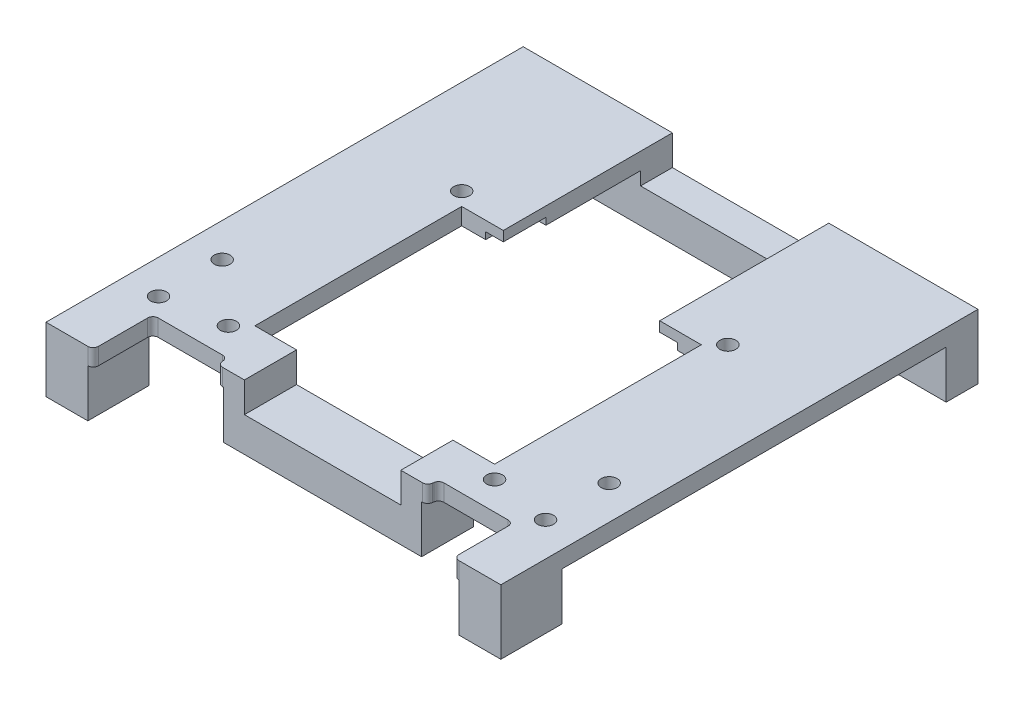
from build123d import *

# Parameters (mm, degrees)
BOSS_EXTRUDE4_DEPTH    = 1.5875
M3_CLEARANCE_HOLE3_D   = 3
M3_CLEARANCE_HOLE1_D   = 3.1
M3_CLEARANCE_HOLE4_D   = 2.95
M3_CLEARANCE_HOLE2_D   = 3.1
M3_CLEARANCE_HOLE5_D   = 3
BOSS_EXTRUDE6_START    = -3.175
BOSS_EXTRUDE6_DEPTH    = 3.175
FILLET1_R              = 2
CUT_EXTRUDE4_START     = -1.5875
CUT_EXTRUDE4_OUTLINE_W = 45.2
CUT_EXTRUDE4_OUTLINE_H = 39
CUT_EXTRUDE4_OUTLINE_R = 1.5
CUT_EXTRUDE4_DEPTH     = 3.175
CUT_EXTRUDE4_2_DEPTH   = 3.175
SKETCH29_W             = 29.5
SKETCH29_H             = 74
CUT_EXTRUDE5_DEPTH     = 121.250075364
SKETCH30_R             = 1.5
CUT_EXTRUDE6_DEPTH     = 121.250075364
SKETCH31_W             = 36.15971715
SKETCH31_H             = 8.2
CUT_EXTRUDE7_DEPTH     = 1.3
SKETCH32_OUTSIDE_W     = 217.324
SKETCH32_OUTSIDE_H     = 197.151
SKETCH32_OUTSIDE_W_2   = 85.788981544
SKETCH32_OUTSIDE_H_2   = 90
CUT_EXTRUDE8_DEPTH     = 121.250075364
SKETCH33_W             = 7.894490772
SKETCH33_H             = 11.5
SKETCH33_W_2           = 37.35
SKETCH33_H_2           = 9.832970801
SKETCH33_W_3           = 85.788981544
SKETCH33_H_3           = 6
BOSS_EXTRUDE9_DEPTH    = 9
SKETCH34_W             = 29.5
SKETCH34_H             = 9.832970801
CUT_EXTRUDE9_DEPTH     = 2.5
SKETCH35_W             = 29.5
SKETCH35_H             = 7.081145589
CUT_EXTRUDE10_DEPTH    = 5.675


# Read off the part's stored shape, not the designer's step: Cut-Extrude4
with BuildPart() as part:
    # Sketch1 → Boss-Extrude4 (new, symmetric)
    with BuildSketch(Plane(origin=(0, 0, 0), x_dir=(1, 0, 0), z_dir=(0, 1, 0))):
        with BuildLine():
            Line((-62.799553621, 32.496136604), (-73.969425011, 32.691107434))
            Line((-73.969425011, 32.691107434), (-77.053684287, 35.88495141))
            ThreePointArc((-77.053684287, 35.88495141), (-84.36642289, 10.358894189), (-83.446216027, -16.178041625))
            Line((-83.446216027, -16.178041625), (-79.680911643, -13.825218315))
            Line((-79.680911643, -13.825218315), (-69.484649137, -16.179210996))
            Line((-69.484649137, -16.179210996), (-43.894490772, -57.132025032))
            Line((-43.894490772, -57.132025032), (-43.894490772, -64.826600275))
            Line((-43.894490772, -64.826600275), (-43.094490772, -64.826600275))
            Line((-43.094490772, -64.826600275), (-34, -64.826600275))
            Line((-34, -64.826600275), (-34, -55.55))
            Line((-34, -55.55), (-34, -53.55))
            Line((-34, -53.55), (-20, -53.55))
            Line((-20, -53.55), (-19.718918331, -55.55))
            Line((-19.718918331, -55.55), (19.718918331, -55.55))
            Line((19.718918331, -55.55), (20, -53.55))
            Line((20, -53.55), (34, -53.55))
            Line((34, -53.55), (34, -55.55))
            Line((34, -55.55), (34, -64.826600275))
            Line((34, -64.826600275), (43.094490772, -64.826600275))
            Line((43.094490772, -64.826600275), (43.894490772, -64.826600275))
            Line((43.894490772, -64.826600275), (43.894490772, -57.132025032))
            Line((43.894490772, -57.132025032), (69.484649137, -16.179210996))
            Line((69.484649137, -16.179210996), (79.680911643, -13.825218315))
            Line((79.680911643, -13.825218315), (83.446216027, -16.178041625))
            ThreePointArc((83.446216027, -16.178041625), (84.610662337, -8.126242604), (85, 0))
            ThreePointArc((85, 0), (82.98964744, 18.377116688), (77.053684287, 35.88495141))
            Line((77.053684287, 35.88495141), (73.969425011, 32.691107434))
            Line((73.969425011, 32.691107434), (62.799553621, 32.496136604))
            Line((62.799553621, 32.496136604), (30.284668021, 63.895396642))
            Line((30.284668021, 63.895396642), (30.089697191, 75.065268032))
            Line((30.089697191, 75.065268032), (33.173956467, 78.259112008))
            ThreePointArc((33.173956467, 78.259112008), (0, 85), (-33.173956467, 78.259112008))
            Line((-33.173956467, 78.259112008), (-30.089697191, 75.065268032))
            Line((-30.089697191, 75.065268032), (-30.284668021, 63.895396642))
            Line((-30.284668021, 63.895396642), (-62.799553621, 32.496136604))
        make_face()
    extrude(amount=BOSS_EXTRUDE4_DEPTH, both=True)

    # M3 Clearance Hole3 (through all)
    with Locations(Plane(origin=(0, -1.5875, 0), x_dir=(-1, 0, 0), z_dir=(0, -1, 0))):
        with Locations((36.5, -50), (36.5, -38), (-36.5, -50), (-36.5, -38)):
            Hole(M3_CLEARANCE_HOLE3_D / 2)

    # M3 Clearance Hole1 (through all)
    with Locations(Plane(origin=(0, 1.5875, 0), x_dir=(1, 0, 0), z_dir=(0, 1, 0))):
        with Locations((-78.542321426, -8.49139241), (78.542321426, -8.49139241), (74.155025063, 27.240269049), (-74.155025063, 27.240269049)):
            Hole(M3_CLEARANCE_HOLE1_D / 2)

    # M3 Clearance Hole4 (through all)
    with Locations(Plane(origin=(0, -1.5875, 0), x_dir=(-1, 0, 0), z_dir=(0, -1, 0))):
        with Locations((-67.099301622, -15.278865202), (-50.141885166, -42.416404279), (-61.062544382, 30.698137949), (-38.043670771, 52.927205804), (50.141885166, -42.416404279), (67.099301622, -15.278865202), (38.043670771, 52.927205804), (61.062544382, 30.698137949)):
            Hole(M3_CLEARANCE_HOLE4_D / 2)

    # M3 Clearance Hole2 (through all)
    with Locations(Plane(origin=(0, 1.5875, 0), x_dir=(1, 0, 0), z_dir=(0, 1, 0))):
        with Locations((27, 76.497766718), (-27, 76.497766718)):
            Hole(M3_CLEARANCE_HOLE2_D / 2)

    # M3 Clearance Hole5 (through all)
    with Locations(Plane(origin=(0, 1.5875, 0), x_dir=(1, 0, 0), z_dir=(0, 1, 0))):
        with Locations((-11, -4.4), (11, -4.4), (11, -36.4), (-11, -36.4), (-11, 37.6), (11, 37.6)):
            Hole(M3_CLEARANCE_HOLE5_D / 2)

    # Sketch22 → Boss-Extrude6 (add)
    with BuildSketch(Plane(origin=(0, 1.5875, 0), x_dir=(1, 0, 0), z_dir=(0, 1, 0)).offset(BOSS_EXTRUDE6_START)):
        Polygon((65.061950694, 32.535626892), (30.245177733, 66.157793715), (30.284668021, 63.895396642), (62.799553621, 32.496136604), align=None)
        Polygon((-30.284668021, 63.895396642), (-30.245177733, 66.157793715), (-65.061950694, 32.535626892), (-62.799553621, 32.496136604), align=None)
        Polygon((43.894490772, -60.151352895), (71.689396914, -15.670204865), (69.484649137, -16.179210996), (43.894490772, -57.132025032), align=None)
        Polygon((-69.484649137, -16.179210996), (-71.689396914, -15.670204865), (-43.894490772, -60.151352895), (-43.894490772, -57.132025032), align=None)
    extrude(amount=BOSS_EXTRUDE6_DEPTH)

    # Fillet1
    fillet1_edges = [part.edges().sort_by_distance(p)[0] for p in [
        (-30.245177733, -0.79375, -66.157793715),
        (-65.061950694, -0.79375, -32.535626892),
        (-71.689396914, 0.79375, 15.670204865),
        (-43.894490772, 0.79375, 60.151352895),
        (43.894490772, -0.79375, 60.151352895),
        (71.689396914, -0.79375, 15.670204865),
        (65.061950694, -0.79375, -32.535626892),
        (30.245177733, 0.79375, -66.157793715),
        (30.089697191, -0.79375, -75.065268032),
        (73.969425011, -0.79375, -32.691107434),
        (79.680911643, -0.79375, 13.825218315),
        (-79.680911643, -0.79375, 13.825218315),
        (-73.969425011, -0.79375, -32.691107434),
        (-30.089697191, -0.79375, -75.065268032),
    ]]
    fillet(fillet1_edges, radius=FILLET1_R)

    # Cut-Extrude4 outline → Cut-Extrude4 (cut)
    # profile 1 of 13: a face of its own
    with BuildSketch(Plane(origin=(0, 0, 0), x_dir=(1, 0, 0), z_dir=(0, 1, 0)).offset(CUT_EXTRUDE4_START)):
        with BuildLine():
            Line((-43.894490772, -64.826600275), (-42.894490772, -64.826600275))
            ThreePointArc((-42.894490772, -64.826600275), (-43.601597553, -64.533707056), (-43.894490772, -63.826600275))
            Line((-43.894490772, -63.826600275), (-43.894490772, -64.826600275))
        make_face()
    # profile 2 of 13: a face of its own
    with BuildSketch(Plane(origin=(0, 0, 0), x_dir=(1, 0, 0), z_dir=(0, 1, 0)).offset(CUT_EXTRUDE4_START)):
        with BuildLine():
            ThreePointArc((43.894490772, -63.826600275), (43.601597553, -64.533707056), (42.894490772, -64.826600275))
            Line((42.894490772, -64.826600275), (43.894490772, -64.826600275))
            Line((43.894490772, -64.826600275), (43.894490772, -63.826600275))
        make_face()
    # profile 3 of 13: a face of its own
    with BuildSketch(Plane(origin=(0, 0, 0), x_dir=(1, 0, 0), z_dir=(0, 1, 0)).offset(CUT_EXTRUDE4_START)):
        with BuildLine():
            ThreePointArc((35, -64.826600275), (34.292893219, -64.533707056), (34, -63.826600275))
            Line((34, -63.826600275), (34, -64.826600275))
            Line((34, -64.826600275), (35, -64.826600275))
        make_face()
    # profile 4 of 13: a face of its own
    with BuildSketch(Plane(origin=(0, 0, 0), x_dir=(1, 0, 0), z_dir=(0, 1, 0)).offset(CUT_EXTRUDE4_START)):
        with BuildLine():
            ThreePointArc((19.839899662, -54.689173101), (19.505690622, -55.30470958), (18.849631593, -55.55))
            Line((18.849631593, -55.55), (19.718918331, -55.55))
            Line((19.718918331, -55.55), (19.839899662, -54.689173101))
        make_face()
    # profile 5 of 13: a face of its own
    with BuildSketch(Plane(origin=(0, 0, 0), x_dir=(1, 0, 0), z_dir=(0, 1, 0)).offset(CUT_EXTRUDE4_START)):
        with BuildLine():
            ThreePointArc((-18.849631593, -55.55), (-19.505690622, -55.30470958), (-19.839899662, -54.689173101))
            Line((-19.839899662, -54.689173101), (-19.718918331, -55.55))
            Line((-19.718918331, -55.55), (-18.849631593, -55.55))
        make_face()
    # profile 6 of 13: a face of its own
    with BuildSketch(Plane(origin=(0, 0, 0), x_dir=(1, 0, 0), z_dir=(0, 1, 0)).offset(CUT_EXTRUDE4_START)):
        with BuildLine():
            ThreePointArc((-34, -63.826600275), (-34.292893219, -64.533707056), (-35, -64.826600275))
            Line((-35, -64.826600275), (-34, -64.826600275))
            Line((-34, -64.826600275), (-34, -63.826600275))
        make_face()
    # profile 7 of 13: a face of its own
    with BuildSketch(Plane(origin=(0, 0, 0), x_dir=(1, 0, 0), z_dir=(0, 1, 0)).offset(CUT_EXTRUDE4_START)):
        with BuildLine():
            Line((-83.446216027, -16.178041625), (-82.20011414, -15.399390747))
            ThreePointArc((-82.20011414, -15.399390747), (-83.136963865, -15.464801791), (-83.714914754, -14.72457292))
            ThreePointArc((-83.714914754, -14.72457292), (-83.583724815, -15.451891346), (-83.446216027, -16.178041625))
        make_face()
    # profile 8 of 13: a face of its own
    with BuildSketch(Plane(origin=(0, 0, 0), x_dir=(1, 0, 0), z_dir=(0, 1, 0)).offset(CUT_EXTRUDE4_START)):
        with BuildLine():
            ThreePointArc((-77.053684287, 35.88495141), (-77.362780128, 35.213637285), (-77.666027418, 34.539661043))
            ThreePointArc((-77.666027418, 34.539661043), (-76.926166569, 35.118082978), (-76.032969649, 34.82797046))
            Line((-76.032969649, 34.82797046), (-77.053684287, 35.88495141))
        make_face()
    # profile 9 of 13: a face of its own
    with BuildSketch(Plane(origin=(0, 0, 0), x_dir=(1, 0, 0), z_dir=(0, 1, 0)).offset(CUT_EXTRUDE4_START)):
        with BuildLine():
            Line((-33.173956467, 78.259112008), (-32.153241828, 77.202131058))
            ThreePointArc((-32.153241828, 77.202131058), (-32.412005494, 78.104908648), (-31.808115147, 78.82413216))
            ThreePointArc((-31.808115147, 78.82413216), (-32.492263999, 78.544591031), (-33.173956467, 78.259112008))
        make_face()
    # profile 10 of 13: a face of its own
    with BuildSketch(Plane(origin=(0, 0, 0), x_dir=(1, 0, 0), z_dir=(0, 1, 0)).offset(CUT_EXTRUDE4_START)):
        with BuildLine():
            ThreePointArc((33.173956467, 78.259112008), (32.492263999, 78.544591031), (31.808115147, 78.82413216))
            ThreePointArc((31.808115147, 78.82413216), (32.412005494, 78.104908648), (32.153241828, 77.202131058))
            Line((32.153241828, 77.202131058), (33.173956467, 78.259112008))
        make_face()
    # profile 11 of 13: a face of its own
    with BuildSketch(Plane(origin=(0, 0, 0), x_dir=(1, 0, 0), z_dir=(0, 1, 0)).offset(CUT_EXTRUDE4_START)):
        with BuildLine():
            Line((77.053684287, 35.88495141), (76.032969649, 34.82797046))
            ThreePointArc((76.032969649, 34.82797046), (76.926166569, 35.118082978), (77.666027419, 34.539661043))
            ThreePointArc((77.666027419, 34.539661043), (77.362780128, 35.213637285), (77.053684287, 35.88495141))
        make_face()
    # profile 12 of 13: a face of its own
    with BuildSketch(Plane(origin=(0, 0, 0), x_dir=(1, 0, 0), z_dir=(0, 1, 0)).offset(CUT_EXTRUDE4_START)):
        with BuildLine():
            ThreePointArc((83.446216027, -16.178041625), (83.583724815, -15.451891346), (83.714914755, -14.72457292))
            ThreePointArc((83.714914755, -14.72457292), (83.136963865, -15.464801791), (82.20011414, -15.399390747))
            Line((82.20011414, -15.399390747), (83.446216027, -16.178041625))
        make_face()
    # profile 13 of 13: a face of its own
    with BuildSketch(Plane(origin=(0, 0, 0), x_dir=(1, 0, 0), z_dir=(0, 1, 0)).offset(CUT_EXTRUDE4_START)):
        with Locations((0, -26.217029199)):
            Rectangle(CUT_EXTRUDE4_OUTLINE_W, CUT_EXTRUDE4_OUTLINE_H)
        with Locations((-11, -36.4)):
            Circle(CUT_EXTRUDE4_OUTLINE_R, mode=Mode.SUBTRACT)
        with Locations((11, -36.4)):
            Circle(CUT_EXTRUDE4_OUTLINE_R, mode=Mode.SUBTRACT)
    extrude(amount=CUT_EXTRUDE4_DEPTH, mode=Mode.SUBTRACT)

    # Cut-Extrude4 2 outline → Cut-Extrude4 2 (add)
    with BuildSketch(Plane(origin=(0, 0, 0), x_dir=(1, 0, 0), z_dir=(0, 1, 0)).offset(CUT_EXTRUDE4_START)):
        with BuildLine():
            Line((34, -53.55), (33, -53.55))
            ThreePointArc((33, -53.55), (33.707106781, -53.842893219), (34, -54.55))
            Line((34, -54.55), (34, -53.55))
        make_face()
        with BuildLine():
            Line((20, -53.55), (19.879018669, -54.410826899))
            ThreePointArc((19.879018669, -54.410826899), (20.213227709, -53.79529042), (20.869286738, -53.55))
            Line((20.869286738, -53.55), (20, -53.55))
        make_face()
        with BuildLine():
            Line((-20, -53.55), (-20.869286738, -53.55))
            ThreePointArc((-20.869286738, -53.55), (-20.213227709, -53.79529042), (-19.879018669, -54.410826899))
            Line((-19.879018669, -54.410826899), (-20, -53.55))
        make_face()
        with BuildLine():
            Line((-34, -53.55), (-34, -54.55))
            ThreePointArc((-34, -54.55), (-33.707106781, -53.842893219), (-33, -53.55))
            Line((-33, -53.55), (-34, -53.55))
        make_face()
    extrude(amount=CUT_EXTRUDE4_2_DEPTH)

    # Sketch29 → Cut-Extrude5 (cut, through all)
    with BuildSketch(Plane(origin=(0, 1.5875, 0), x_dir=(1, 0, 0), z_dir=(0, 1, 0))):
        with Locations((0, -18.907745864)):
            Rectangle(SKETCH29_W, SKETCH29_H)
    extrude(amount=-CUT_EXTRUDE5_DEPTH, mode=Mode.SUBTRACT)

    # Sketch30 → Cut-Extrude6 (cut, through all)
    with BuildSketch(Plane(origin=(0, 1.5875, 0), x_dir=(1, 0, 0), z_dir=(0, 1, 0))):
        with Locations(Location((25.1, -48.217029199, 0), (0, 0, 270))):
            Circle(SKETCH30_R)
        with Locations(Location((25.1, -4.217029199, 0), (0, 0, 270))):
            Circle(SKETCH30_R)
        with Locations(Location((-25.1, -4.217029199, 0), (0, 0, 270))):
            Circle(SKETCH30_R)
        with Locations(Location((-25.1, -48.217029199, 0), (0, 0, 270))):
            Circle(SKETCH30_R)
    extrude(amount=-CUT_EXTRUDE6_DEPTH, mode=Mode.SUBTRACT)

    # Sketch31 → Cut-Extrude7 (cut)
    with BuildSketch(Plane.XZ.offset(1.5875)):
        with Locations((0, 2.777878312)):
            Rectangle(SKETCH31_W, SKETCH31_H)
    extrude(amount=-CUT_EXTRUDE7_DEPTH, mode=Mode.SUBTRACT)

    # Sketch32 outside → Cut-Extrude8 (cut, through all)
    with BuildSketch(Plane(origin=(0, 1.5875, 0), x_dir=(1, 0, 0), z_dir=(0, 1, 0))):
        with Locations((0, 10.0865)):
            Rectangle(SKETCH32_OUTSIDE_W, SKETCH32_OUTSIDE_H)
        with Locations((0, -19.826600275)):
            Rectangle(SKETCH32_OUTSIDE_W_2, SKETCH32_OUTSIDE_H_2, mode=Mode.SUBTRACT)
    extrude(amount=-CUT_EXTRUDE8_DEPTH, mode=Mode.SUBTRACT)

    # Sketch33 → Boss-Extrude9 (add)
    with BuildSketch(Plane.XZ.offset(1.5875)):
        with Locations((-38.947245386, 59.076600275)):
            Rectangle(SKETCH33_W, SKETCH33_H)
        with Locations((38.947245386, 59.076600275)):
            Rectangle(SKETCH33_W, SKETCH33_H)
        with Locations((0, 50.6335146)):
            Rectangle(SKETCH33_W_2, SKETCH33_H_2)
        with Locations((0, -22.173399725)):
            Rectangle(SKETCH33_W_3, SKETCH33_H_3)
    extrude(amount=BOSS_EXTRUDE9_DEPTH)

    # Sketch34 → Cut-Extrude9 (cut)
    with BuildSketch(Plane(origin=(0, -1.5875, 0), x_dir=(1, 0, 0), z_dir=(0, 1, 0))):
        with Locations((0, -50.6335146)):
            Rectangle(SKETCH34_W, SKETCH34_H)
    extrude(amount=-CUT_EXTRUDE9_DEPTH, mode=Mode.SUBTRACT)

    # Sketch35 → Cut-Extrude10 (cut)
    with BuildSketch(Plane(origin=(0, 1.5875, 0), x_dir=(1, 0, 0), z_dir=(0, 1, 0))):
        with Locations((0, 21.632826931)):
            Rectangle(SKETCH35_W, SKETCH35_H)
    extrude(amount=-CUT_EXTRUDE10_DEPTH, mode=Mode.SUBTRACT)


solid = part.part
